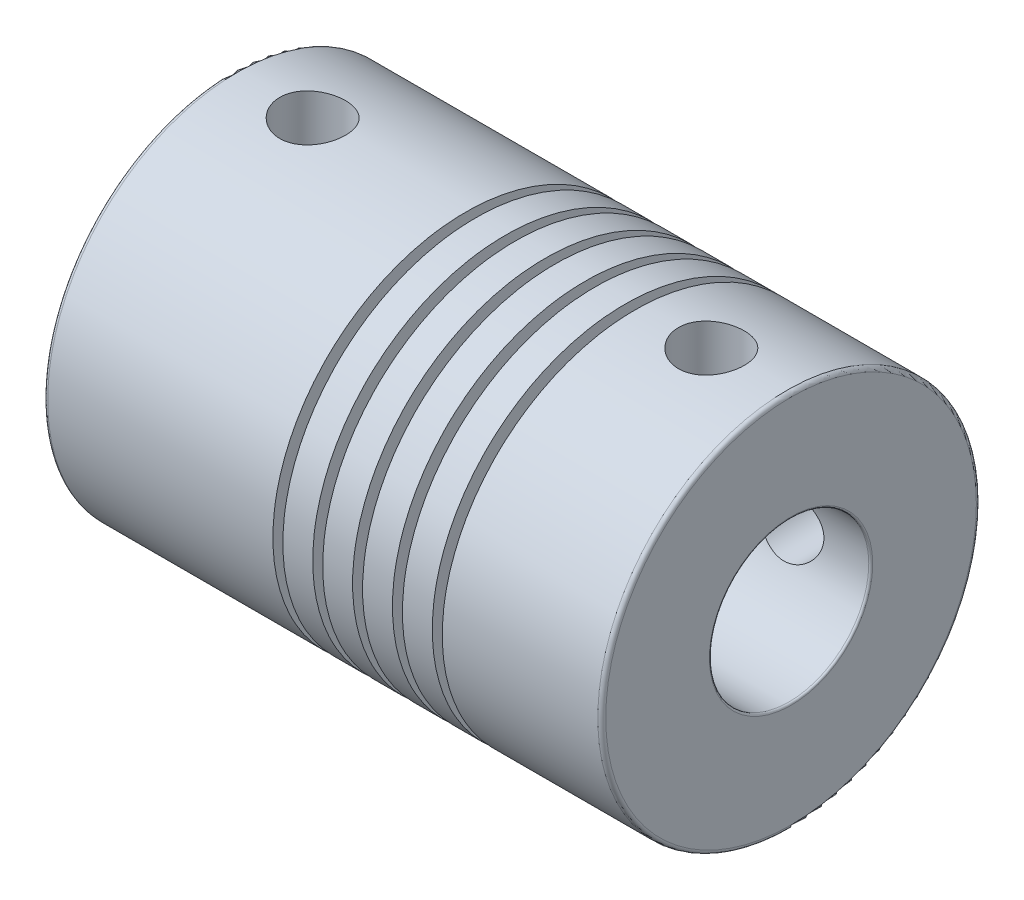
from build123d import *

# Parameters (mm, degrees)
BOSS_EXTRUDE1_DEPTH      = 28
BOSS_EXTRUDE1_DEPTH_BACK = 0.01
SKETCH1_R                = 9.5
SKETCH1_R_2              = 2.5
SKETCH2_R                = 4
CUT_EXTRUDE1_DEPTH       = 18
CUT_SWEEP2_PITCH         = 2
SKETCH8_R                = 1.65
CUT_EXTRUDE3_DEPTH       = 10
SKETCH10_R               = 1.65
CUT_EXTRUDE4_DEPTH       = 11
FILLET1_R                = 0.2
FILLET2_R                = 0.1


with BuildPart() as part:
    # Sketch1 → Boss-Extrude1 (new, two sides: drawn at the far end of the back side and taken through both)
    with BuildSketch(Plane(origin=(0, 0, 0), x_dir=(0, 0, -1), z_dir=(1, 0, 0)).offset(-BOSS_EXTRUDE1_DEPTH_BACK)):
        Circle(SKETCH1_R)
        Circle(SKETCH1_R_2, mode=Mode.SUBTRACT)
    extrude(amount=BOSS_EXTRUDE1_DEPTH + BOSS_EXTRUDE1_DEPTH_BACK)

    # Sketch2 → Cut-Extrude1 (cut)
    with BuildSketch(Plane(origin=(28, 0, 0), x_dir=(0, 0, -1), z_dir=(1, 0, 0))):
        Circle(SKETCH2_R)
    extrude(amount=-CUT_EXTRUDE1_DEPTH, mode=Mode.SUBTRACT)

    # Cut-Sweep2: arcs per turn and ends read off the stored shape
    # Cut-Sweep2: the profile of Sketch3 profile screwed along a left-hand helix through 5 turns, 10 arcs to a turn; built about Z, then put on its axis
    cut_sweep2_z = Axis((0, 0, 0), (0, 0, 1))
    cut_sweep2_corners = [(9.5003, 0, -0.16), (9.5003, 0, 0.34), (4, 0, 0.34), (4, 0, -0.16)]
    with BuildLine(mode=Mode.PRIVATE) as cut_sweep2_profile:
        Line(cut_sweep2_corners[0], cut_sweep2_corners[1])
        Line(cut_sweep2_corners[1], cut_sweep2_corners[2])
        Line(cut_sweep2_corners[2], cut_sweep2_corners[3])
        Line(cut_sweep2_corners[3], cut_sweep2_corners[0])
    cut_sweep2_cap = Face(cut_sweep2_profile.wire())
    cut_sweep2_turn_angles = [0, -18, -36, -54, -72, -90, -108, -126, -144, -162, -180, -198, -216, -234, -252, -270, -288, -306, -324, -342, -360]
    cut_sweep2_turn_weights = [1, 0.9510565162951535, 1, 0.9510565162951535, 1, 0.9510565162951535, 1, 0.9510565162951535, 1, 0.9510565162951535, 1, 0.9510565162951535, 1, 0.9510565162951535, 1, 0.9510565162951535, 1, 0.9510565162951535, 1, 0.9510565162951535, 1]
    cut_sweep2_turn_rails = [Edge.make_bspline([Vector(p[0], p[1], 0).rotate(cut_sweep2_z, cut_sweep2_turn_angles[k]) / cut_sweep2_turn_weights[k] + Vector(0, 0, p[2] + -CUT_SWEEP2_PITCH * cut_sweep2_turn_angles[k] / 360) for k in range(21)], [0, 0, 0, 1, 1, 2, 2, 3, 3, 4, 4, 5, 5, 6, 6, 7, 7, 8, 8, 9, 9, 10, 10, 10], 2, cut_sweep2_turn_weights) for p in cut_sweep2_corners]
    cut_sweep2_turn_sides = [Face.make_surface_from_curves(cut_sweep2_turn_rails[p[0]], cut_sweep2_turn_rails[p[1]]) for p in [(0, 1), (1, 2), (2, 3), (3, 0)]]
    cut_sweep2 = Plane(origin=(20.59, 0, 0), x_dir=(0, 0.7071067811865438, -0.7071067811865513), z_dir=(-1, 0, 0)) * Solid(Shell([*[p.moved(Location((0, 0, CUT_SWEEP2_PITCH * i))) for i in range(5) for p in cut_sweep2_turn_sides], cut_sweep2_cap, cut_sweep2_cap.rotate(cut_sweep2_z, -1800).moved(Location((0, 0, -CUT_SWEEP2_PITCH * -1800 / 360)))]))
    add(cut_sweep2, mode=Mode.SUBTRACT)

    # Sketch8 → Cut-Extrude3 (cut)
    with BuildSketch(Plane.XY):
        with Locations((4, 0)):
            Circle(SKETCH8_R)
        with Locations((24, 0)):
            Circle(SKETCH8_R)
    extrude(amount=-CUT_EXTRUDE3_DEPTH, mode=Mode.SUBTRACT)

    # Sketch10 → Cut-Extrude4 (cut)
    with BuildSketch(Plane(origin=(0, 0, 0), x_dir=(1, 0, 0), z_dir=(0, 1, 0))):
        with Locations(Location((3.99, 0, 0), (0, 0, 90))):
            Circle(SKETCH10_R)
        with Locations(Location((24, 0, 0), (0, 0, 90))):
            Circle(SKETCH10_R)
    extrude(amount=CUT_EXTRUDE4_DEPTH, mode=Mode.SUBTRACT)

    # Fillet1
    fillet1_edges = [part.edges().sort_by_distance(p)[0] for p in [
        (-0.01, 0, 9.5),
        (28, 0, 9.5),
    ]]
    fillet(fillet1_edges, radius=FILLET1_R)

    # Fillet2
    fillet2_edges = [part.edges().sort_by_distance(p)[0] for p in [
        (28, 0, 4),
        (-0.01, 0, 2.5),
    ]]
    fillet(fillet2_edges, radius=FILLET2_R)


solid = part.part
